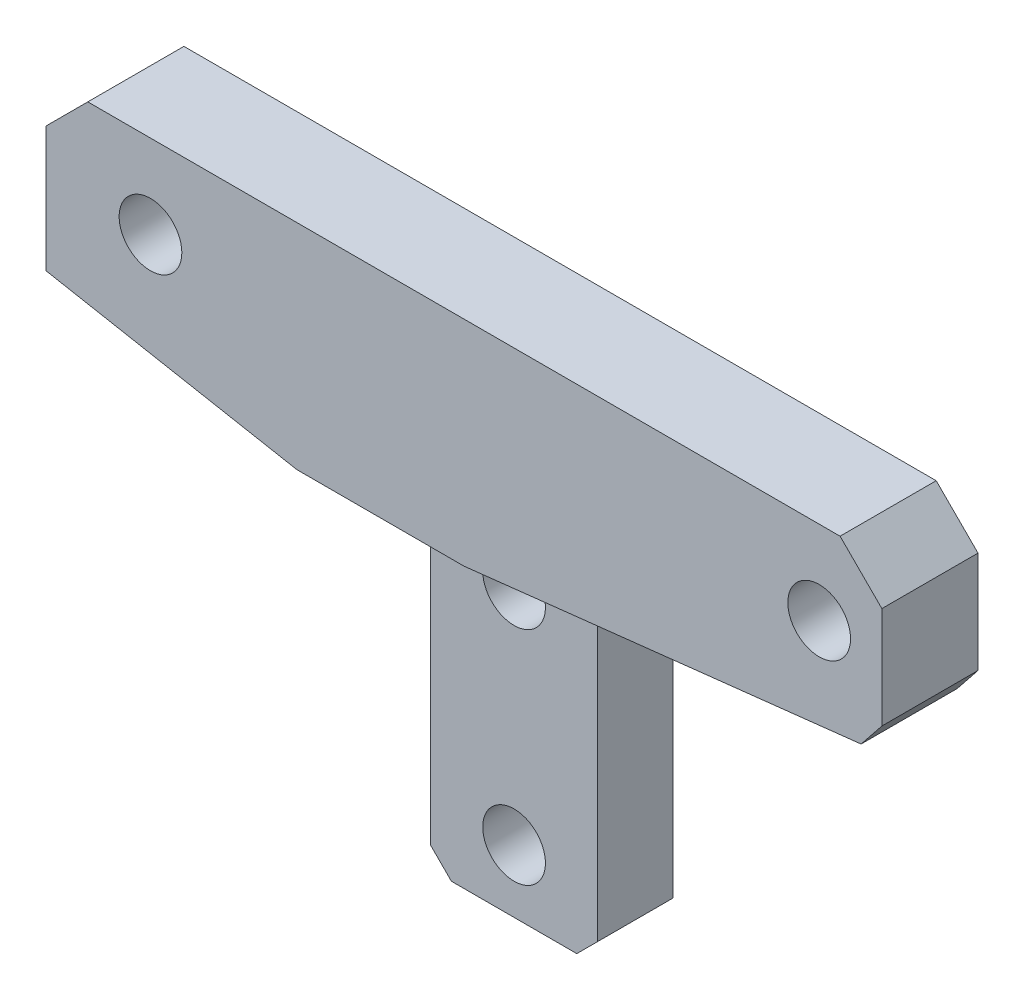
from build123d import *

# Parameters (mm, degrees)
SKETCH_1_R          = 0.75
EXTRUDE_2_DEPTH     = 5.5
CUT_EXTRUDE_START   = 3.2
SKETCH_3_W          = 4
SKETCH_3_H          = 9.88
SKETCH_3_R          = 0.75
CUT_EXTRUDE_2_DEPTH = 3.2
CHAMFER_1_SIZE      = 1
CHAMFER_2_SIZE      = 1
CHAMFER_3_SIZE      = 0.5
SKETCH_4_R          = 0.75
CUT_EXTRUDE_3_DEPTH = 3.2
CHAMFER_4_SIZE      = 0.5
CHAMFER_4_SIZE2     = 0.566583589
CUT_EXTRUDE_4_DEPTH = 0.5


with BuildPart() as part:
    # 草图1 → 凸台-拉伸2 (new body)
    with BuildSketch(Plane.XY):
        Polygon((-10, 2), (10, 2), (10, -2), (0, -3.12), (0, -13), (-4, -13), (-4, -3.12), (-10, -2), align=None)
        with Locations((-7.5, 0)):
            Circle(SKETCH_1_R, mode=Mode.SUBTRACT)
        with Locations((8.5, 0)):
            Circle(SKETCH_1_R, mode=Mode.SUBTRACT)
        with Locations((-2, -11.5)):
            Circle(SKETCH_1_R, mode=Mode.SUBTRACT)
        with Locations((-2, -6.2)):
            Circle(SKETCH_1_R, mode=Mode.SUBTRACT)
    extrude(amount=EXTRUDE_2_DEPTH)

    # 草图3 → 切除-拉伸2 (cut)
    with BuildSketch(Plane(origin=(0, 0, 5.5), x_dir=(-1, 0, 0), z_dir=(0, 0, -1)).offset(CUT_EXTRUDE_START)):
        with Locations((2, -8.06)):
            Rectangle(SKETCH_3_W, SKETCH_3_H)
        with Locations((2, -11.5)):
            Circle(SKETCH_3_R, mode=Mode.SUBTRACT)
        with Locations((2, -6.2)):
            Circle(SKETCH_3_R, mode=Mode.SUBTRACT)
    extrude(amount=-CUT_EXTRUDE_2_DEPTH, mode=Mode.SUBTRACT)

    # 倒角1
    chamfer_1_edges = [part.edges().sort_by_distance(p)[0] for p in [
        (-2, -3.12, 2.3),
    ]]
    chamfer(chamfer_1_edges, length=CHAMFER_1_SIZE)

    # 倒角2
    chamfer_2_edges = [part.edges().sort_by_distance(p)[0] for p in [
        (-10, 2, 2.75),
        (10, 2, 2.75),
    ]]
    chamfer(chamfer_2_edges, length=CHAMFER_2_SIZE)

    # 倒角3
    chamfer_3_edges = [part.edges().sort_by_distance(p)[0] for p in [
        (-4, -13, 1.15),
        (0, -13, 1.15),
    ]]
    chamfer(chamfer_3_edges, length=CHAMFER_3_SIZE)

    # 草图4 → 切除-拉伸3 (cut)
    with BuildSketch(Plane.XY):
        Polygon((-10, -2.5), (10, -2.5), (10, 1), (9, 2), (-9, 2), (-10, 1), align=None)
        with Locations((8.5, 0)):
            Circle(SKETCH_4_R, mode=Mode.SUBTRACT)
        with Locations((-7.5, 0)):
            Circle(SKETCH_4_R, mode=Mode.SUBTRACT)
    extrude(amount=CUT_EXTRUDE_3_DEPTH, mode=Mode.SUBTRACT)

    # 倒角4
    chamfer_4_edges = [part.edges().sort_by_distance(p)[0] for p in [
        (10, -2, 4.35),
    ]]
    chamfer_4_side = [part.faces().sort_by_distance(p)[0] for p in [
        (4.028822055, -2.66877193, 3.153508772),
    ]]
    chamfer(chamfer_4_edges, length=CHAMFER_4_SIZE, length2=CHAMFER_4_SIZE2, reference=chamfer_4_side[0])

    # 草图5 → 切除-拉伸4 (cut)
    with BuildSketch(Plane(origin=(0, 0, 0), x_dir=(-1, 0, 0), z_dir=(0, 0, -1))):
        Polygon((4, -3.12), (7.321428571, -2.5), (-5.535714286, -2.5), (0, -3.12), (0, -12.5), (0.5, -13), (3.5, -13), (4, -12.5), align=None)
    extrude(amount=-CUT_EXTRUDE_4_DEPTH, mode=Mode.SUBTRACT)


solid = part.part
